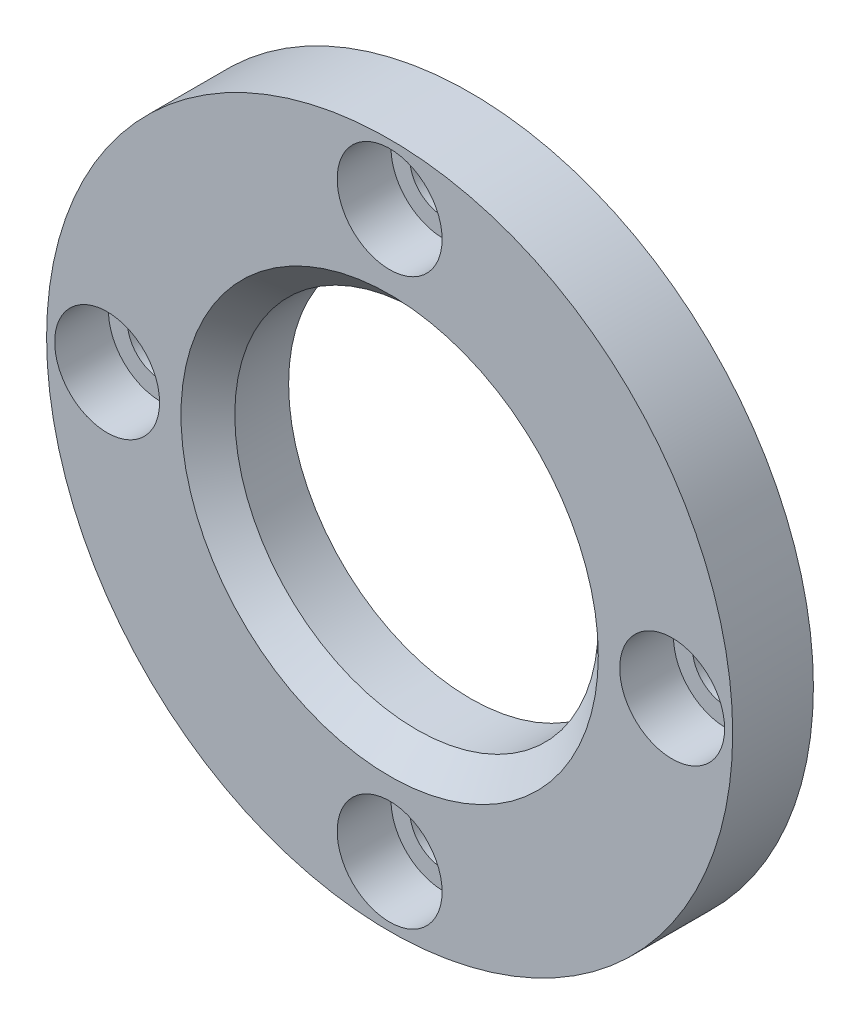
from build123d import *

# Parameters (mm, degrees)
SKETCH_1_R          = 12.75
SKETCH_1_R_2        = 1.25
SKETCH_1_R_3        = 6.755
EXTRUDE_1_DEPTH     = 3
SKETCH_2_R          = 1.95
CUT_EXTRUDE_1_DEPTH = 2
CHAMFER_1_SIZE      = 1


with BuildPart() as part:
    # Эскиз1 → Бобышка-Вытянуть1 (new body)
    with BuildSketch(Plane.XY):
        Circle(SKETCH_1_R)
        with Locations((0, 10.5)):
            Circle(SKETCH_1_R_2, mode=Mode.SUBTRACT)
        with Locations((10.5, 0)):
            Circle(SKETCH_1_R_2, mode=Mode.SUBTRACT)
        with Locations((0, -10.5)):
            Circle(SKETCH_1_R_2, mode=Mode.SUBTRACT)
        with Locations((-10.5, 0)):
            Circle(SKETCH_1_R_2, mode=Mode.SUBTRACT)
        Circle(SKETCH_1_R_3, mode=Mode.SUBTRACT)
    extrude(amount=EXTRUDE_1_DEPTH)

    # Эскиз2 → Вырез-Вытянуть1 (cut)
    with BuildSketch(Plane.XY.offset(3)):
        with Locations((0, 10.5)):
            Circle(SKETCH_2_R)
        with Locations((10.5, 0)):
            Circle(SKETCH_2_R)
        with Locations((0, -10.5)):
            Circle(SKETCH_2_R)
        with Locations((-10.5, 0)):
            Circle(SKETCH_2_R)
    extrude(amount=-CUT_EXTRUDE_1_DEPTH, mode=Mode.SUBTRACT)

    # Фаска1
    chamfer_1_edges = [part.edges().sort_by_distance(p)[0] for p in [
        (-6.755, 0, 3),
    ]]
    chamfer(chamfer_1_edges, length=CHAMFER_1_SIZE)


solid = part.part
